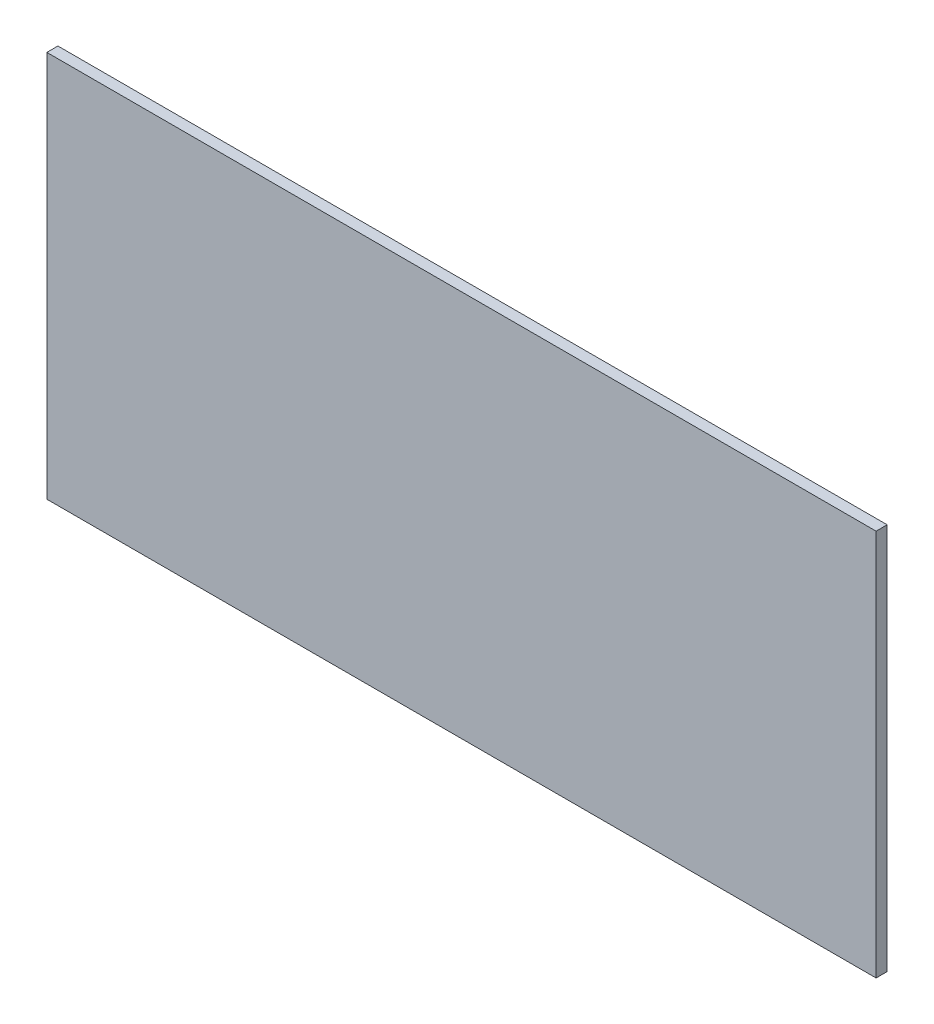
from build123d import *

# Parameters (mm, degrees)
SKETCH1_W           = 300
SKETCH1_H           = 140
BOSS_EXTRUDE1_DEPTH = 4
SKETCH2_R           = 1.5
CUT_EXTRUDE1_DEPTH  = 3.5


with BuildPart() as part:
    # Sketch1 → Boss-Extrude1 (new body)
    with BuildSketch(Plane.XY):
        with Locations((150, 70)):
            Rectangle(SKETCH1_W, SKETCH1_H)
    extrude(amount=BOSS_EXTRUDE1_DEPTH)

    # Sketch2 → Cut-Extrude1 (cut, symmetric)
    with BuildSketch(Plane.XY):
        with Locations((15, 15)):
            Circle(SKETCH2_R)
        with Locations((15, 124)):
            Circle(SKETCH2_R)
        with Locations((287, 15)):
            Circle(SKETCH2_R)
        with Locations((287, 124)):
            Circle(SKETCH2_R)
    extrude(amount=CUT_EXTRUDE1_DEPTH, both=True, mode=Mode.SUBTRACT)


solid = part.part
